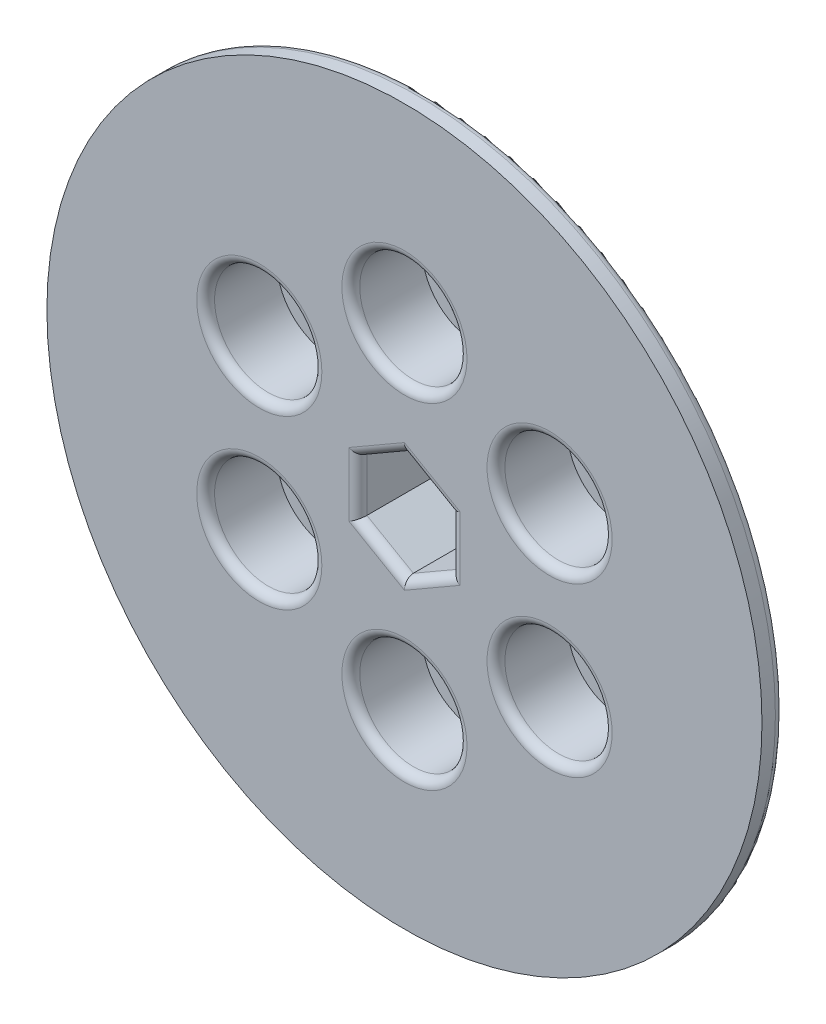
from build123d import *

# Parameters (mm, degrees)
SKETCH1_R           = 31.75
BOSS_EXTRUDE1_DEPTH = 12.7
SKETCH2_R           = 50.8
BOSS_EXTRUDE2_DEPTH = 3.175
CUT_EXTRUDE_R_REACH = 75.575
SKETCH3_R           = 2.667
SKETCH4_R           = 7.62
CUT_EXTRUDE2_DEPTH  = 10.16
FILLET1_R           = 1.27


with BuildPart() as part:
    # Sketch1 → Boss-Extrude1 (new body)
    with BuildSketch(Plane.XY):
        Circle(SKETCH1_R)
    extrude(amount=BOSS_EXTRUDE1_DEPTH)

    # Sketch2 → Boss-Extrude2 (add)
    with BuildSketch(Plane.XY.offset(12.7)):
        Circle(SKETCH2_R)
    extrude(amount=BOSS_EXTRUDE2_DEPTH)

    # Sketch3 → Cut-Extrude r (cut, up to next)
    with BuildSketch(Plane(origin=(0, 0, 0), x_dir=(-1, 0, 0), z_dir=(0, 0, -1)), mode=Mode.PRIVATE) as cut_extrude_r_sk1:
        with Locations((0, 23.8125)):
            Circle(SKETCH3_R)
    cut_extrude_r_tool1 = extrude(cut_extrude_r_sk1.sketch, amount=-CUT_EXTRUDE_R_REACH, mode=Mode.PRIVATE) & part.part
    # Sketch3 → Cut-Extrude r (cut, up to next)
    with BuildSketch(Plane(origin=(0, 0, 0), x_dir=(-1, 0, 0), z_dir=(0, 0, -1)), mode=Mode.PRIVATE) as cut_extrude_r_sk2:
        with Locations((20.622229928, 11.90625)):
            Circle(SKETCH3_R)
    cut_extrude_r_tool2 = extrude(cut_extrude_r_sk2.sketch, amount=-CUT_EXTRUDE_R_REACH, mode=Mode.PRIVATE) & part.part
    # Sketch3 → Cut-Extrude r (cut, up to next)
    with BuildSketch(Plane(origin=(0, 0, 0), x_dir=(-1, 0, 0), z_dir=(0, 0, -1)), mode=Mode.PRIVATE) as cut_extrude_r_sk3:
        with Locations((20.622229928, -11.90625)):
            Circle(SKETCH3_R)
    cut_extrude_r_tool3 = extrude(cut_extrude_r_sk3.sketch, amount=-CUT_EXTRUDE_R_REACH, mode=Mode.PRIVATE) & part.part
    # Sketch3 → Cut-Extrude r (cut, up to next)
    with BuildSketch(Plane(origin=(0, 0, 0), x_dir=(-1, 0, 0), z_dir=(0, 0, -1)), mode=Mode.PRIVATE) as cut_extrude_r_sk4:
        with Locations((0, -23.8125)):
            Circle(SKETCH3_R)
    cut_extrude_r_tool4 = extrude(cut_extrude_r_sk4.sketch, amount=-CUT_EXTRUDE_R_REACH, mode=Mode.PRIVATE) & part.part
    # Sketch3 → Cut-Extrude r (cut, up to next)
    with BuildSketch(Plane(origin=(0, 0, 0), x_dir=(-1, 0, 0), z_dir=(0, 0, -1)), mode=Mode.PRIVATE) as cut_extrude_r_sk5:
        with Locations((-20.622229928, -11.90625)):
            Circle(SKETCH3_R)
    cut_extrude_r_tool5 = extrude(cut_extrude_r_sk5.sketch, amount=-CUT_EXTRUDE_R_REACH, mode=Mode.PRIVATE) & part.part
    # Sketch3 → Cut-Extrude r (cut, up to next)
    with BuildSketch(Plane(origin=(0, 0, 0), x_dir=(-1, 0, 0), z_dir=(0, 0, -1)), mode=Mode.PRIVATE) as cut_extrude_r_sk6:
        with Locations((-20.622229928, 11.90625)):
            Circle(SKETCH3_R)
    cut_extrude_r_tool6 = extrude(cut_extrude_r_sk6.sketch, amount=-CUT_EXTRUDE_R_REACH, mode=Mode.PRIVATE) & part.part
    # Sketch3 → Cut-Extrude r (cut, up to next)
    with BuildSketch(Plane(origin=(0, 0, 0), x_dir=(-1, 0, 0), z_dir=(0, 0, -1)), mode=Mode.PRIVATE) as cut_extrude_r_sk7:
        Polygon((0, 7.625642355), (-6.604, 3.812821178), (-6.604, -3.812821178), (0, -7.625642355), (6.604, -3.812821178), (6.604, 3.812821178), align=None)
    cut_extrude_r_tool7 = extrude(cut_extrude_r_sk7.sketch, amount=-CUT_EXTRUDE_R_REACH, mode=Mode.PRIVATE) & part.part
    add(cut_extrude_r_tool1.solids().sort_by_distance((0, 23.8125, 0))[0], mode=Mode.SUBTRACT)
    add(cut_extrude_r_tool2.solids().sort_by_distance((-20.62223, 11.90625, 0))[0], mode=Mode.SUBTRACT)
    add(cut_extrude_r_tool3.solids().sort_by_distance((-20.62223, -11.90625, 0))[0], mode=Mode.SUBTRACT)
    add(cut_extrude_r_tool4.solids().sort_by_distance((0, -23.8125, 0))[0], mode=Mode.SUBTRACT)
    add(cut_extrude_r_tool5.solids().sort_by_distance((20.62223, -11.90625, 0))[0], mode=Mode.SUBTRACT)
    add(cut_extrude_r_tool6.solids().sort_by_distance((20.62223, 11.90625, 0))[0], mode=Mode.SUBTRACT)
    add(cut_extrude_r_tool7.solids().sort_by_distance((0, 0, 0))[0], mode=Mode.SUBTRACT)

    # Sketch4 → Cut-Extrude2 (cut)
    with BuildSketch(Plane.XY.offset(15.875)):
        with Locations((-20.622229928, -11.90625)):
            Circle(SKETCH4_R)
        with Locations((-20.622229928, 11.90625)):
            Circle(SKETCH4_R)
        with Locations((0, 23.8125)):
            Circle(SKETCH4_R)
        with Locations((20.622229928, 11.90625)):
            Circle(SKETCH4_R)
        with Locations((20.622229928, -11.90625)):
            Circle(SKETCH4_R)
        with Locations((0, -23.8125)):
            Circle(SKETCH4_R)
    extrude(amount=-CUT_EXTRUDE2_DEPTH, mode=Mode.SUBTRACT)

    # Fillet1
    fillet1_edges = [part.edges().sort_by_distance(p)[0] for p in [
        (-50.8, 0, 12.7),
        (-28.242229928, 11.90625, 15.875),
        (-7.62, 23.8125, 15.875),
        (13.002229928, 11.90625, 15.875),
        (13.002229928, -11.90625, 15.875),
        (-28.242229928, -11.90625, 15.875),
        (-7.62, -23.8125, 15.875),
        (6.604, 0, 15.875),
        (3.302, 5.719231767, 15.875),
        (-3.302, 5.719231767, 15.875),
        (-6.604, 0, 15.875),
        (-3.302, -5.719231767, 15.875),
        (3.302, -5.719231767, 15.875),
    ]]
    fillet(fillet1_edges, radius=FILLET1_R)


solid = part.part
